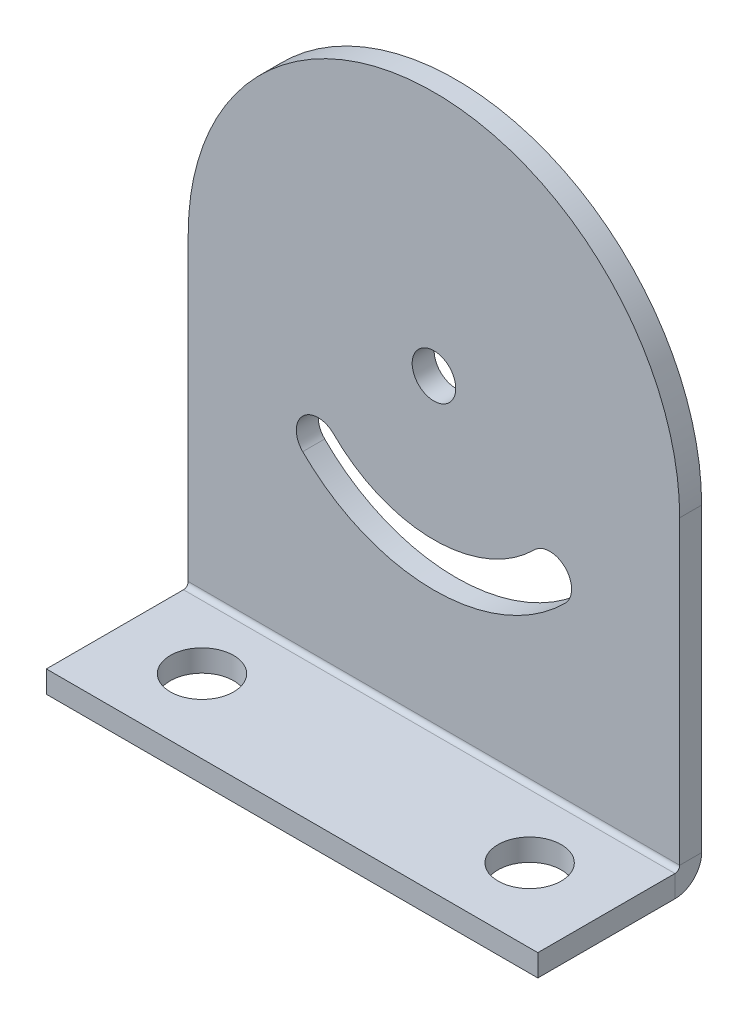
from build123d import *

# Parameters (mm, degrees)
BASE_FLANGE1_DEPTH                = 3.4036
EDGE_FLANGE2_STRIP_W              = 15.0876
EDGE_FLANGE2_STRIP_H              = 3.4036
EDGE_FLANGE2_STRIP_CUT_DEPTH      = 76.2
EDGE_FLANGE2_DEPTH                = 76.2
F_1_4_START                       = -50.8
F_1_4_CLEARANCE_HOLE3_OUTLINE_R   = 4.9022
F_1_4_CLEARANCE_HOLE3_DEPTH       = 3.4036
F_1_4_START_2                     = -3.4036
F_1_4_CLEARANCE_HOLE3_2_OUTLINE_R = 3.3782
F_1_4_CLEARANCE_HOLE3_2_DEPTH     = 3.4036
CUT_EXTRUDE1_DEPTH                = 95.185570089


# Read off the part's stored shape, not the designer's step: 1/4 Clearance Hole3
# Sheet-metal steps are written as plain solids
with BuildPart() as part:
    # Sketch1 → Base-Flange1 (new body)
    with BuildSketch(Plane.XY):
        with BuildLine():
            Line((0, 0), (0, -50.8))
            Line((0, -50.8), (-76.2, -50.8))
            Line((-76.2, -50.8), (-76.2, 0))
            ThreePointArc((-76.2, 0), (-38.1, 38.1), (0, 0))
        make_face()
    extrude(amount=-BASE_FLANGE1_DEPTH)

    # Edge-Flange2 strip (across the edge) → Edge-Flange2 strip cut (cut)
    with BuildSketch(Plane(origin=(-76.2, -50.8, 0), x_dir=(0, 1, 0), z_dir=(1, 0, 0))):
        with Locations((-3.4036, -1.7018)):
            Rectangle(EDGE_FLANGE2_STRIP_W, EDGE_FLANGE2_STRIP_H)
    extrude(amount=EDGE_FLANGE2_STRIP_CUT_DEPTH, mode=Mode.SUBTRACT)

    # Edge-Flange2 section (across the edge) → Edge-Flange2 (add)
    with BuildSketch(Plane(origin=(-76.2, -50.8, 0), x_dir=(0, 1, 0), z_dir=(1, 0, 0))):
        with BuildLine():
            Line((0, 0.7366), (0, 21.9964))
            Line((0, 21.9964), (3.4036, 21.9964))
            Line((3.4036, 21.9964), (3.4036, 0.7366))
            ThreePointArc((3.4036, 0.7366), (3.619345145, 0.215745145), (4.1402, 0))
            Line((4.1402, 0), (4.1402, -3.4036))
            ThreePointArc((4.1402, -3.4036), (1.212636505, -2.190963495), (0, 0.7366))
        make_face()
    extrude(amount=EDGE_FLANGE2_DEPTH)

    # 1/4 Clearance Hole3 outline → 1/4 Clearance Hole3 (cut)
    with BuildSketch(Plane(origin=(0, 0, 0), x_dir=(1, 0, 0), z_dir=(0, 1, 0)).offset(F_1_4_START)):
        with Locations((-12.7, -10.5664)):
            Circle(F_1_4_CLEARANCE_HOLE3_OUTLINE_R)
        with Locations((-63.5, -10.5664)):
            Circle(F_1_4_CLEARANCE_HOLE3_OUTLINE_R)
    extrude(amount=F_1_4_CLEARANCE_HOLE3_DEPTH, mode=Mode.SUBTRACT)

    # 1_4 Clearance Hole3 2 outline → 1_4 Clearance Hole3 2 (cut)
    with BuildSketch(Plane.XY.offset(F_1_4_START_2)):
        with Locations((-38.1, 0)):
            Circle(F_1_4_CLEARANCE_HOLE3_2_OUTLINE_R)
    extrude(amount=F_1_4_CLEARANCE_HOLE3_2_DEPTH, mode=Mode.SUBTRACT)

    # Sketch25 → Cut-Extrude1 (cut, through all)
    with BuildSketch(Plane.XY):
        with BuildLine():
            ThreePointArc((-58.447600474, -20.347600474), (-38.1, -28.775852552), (-17.752399526, -20.347600474))
            ThreePointArc((-17.752399526, -20.347600474), (-17.752399526, -15.570104217), (-22.529895783, -15.570104217))
            ThreePointArc((-22.529895783, -15.570104217), (-38.1, -22.019452552), (-53.670104217, -15.570104217))
            ThreePointArc((-53.670104217, -15.570104217), (-58.447600474, -15.570104217), (-58.447600474, -20.347600474))
        make_face()
    extrude(amount=-CUT_EXTRUDE1_DEPTH, mode=Mode.SUBTRACT)


solid = part.part
